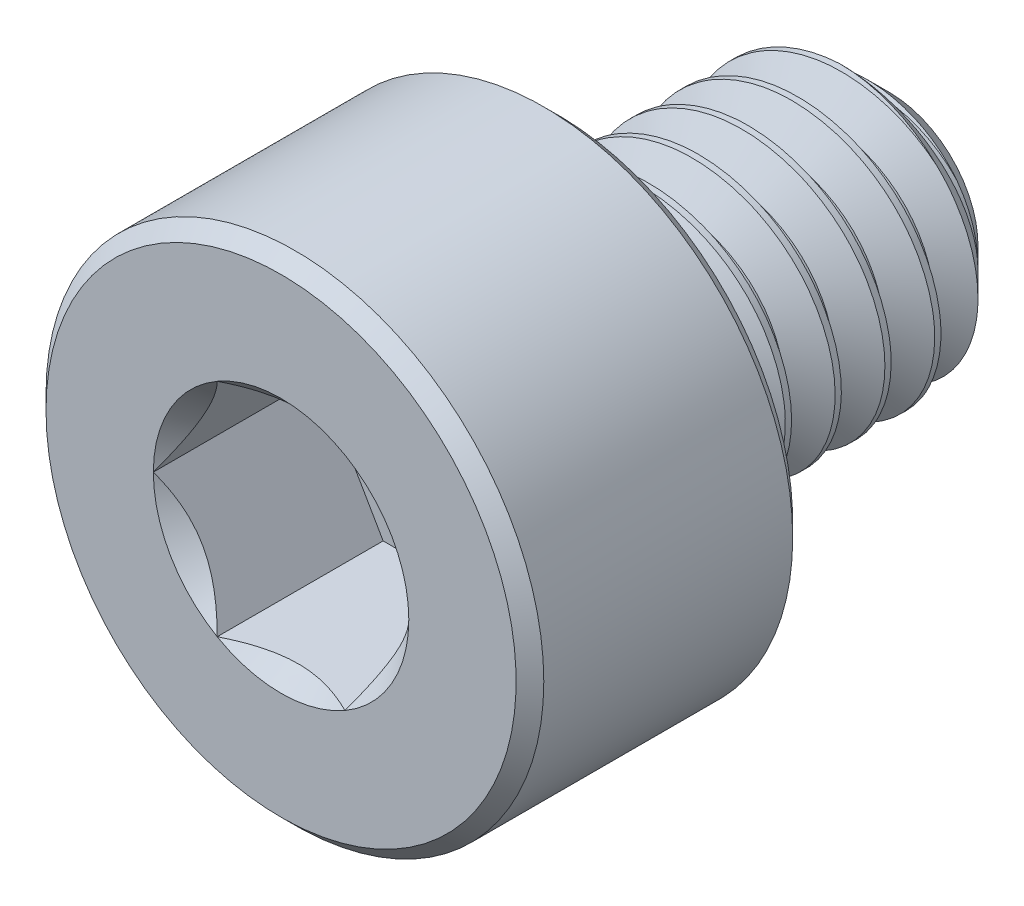
from build123d import *

# Parameters (mm, degrees)
CUT_EXTRUDE1_DEPTH = 1.5
CUT_SWEEP1_PITCH   = 0.45
CUT_SWEEP1_TO      = 3


with BuildPart() as part:
    # Sketch2 → Revolve1 (revolve)
    with BuildSketch(Plane(origin=(0, 0, 0), x_dir=(0, 0, -1), z_dir=(1, 0, 0)), mode=Mode.PRIVATE) as revolve1_sk:
        Polygon((-2.75, 0), (-2.75, 2.125), (-2.625, 2.25), (-0.375, 2.25), (-0.25, 2.125), (-0.25, 1.25), (2.3, 1.25), (2.75, 0.8), (2.75, 0), align=None)
    revolve(revolve1_sk.sketch.rotate(Axis((0, 0, -2.75), (0, 0, 1)), 90), axis=Axis((0, 0, -2.75), (0, 0, 1)))

    # Sketch3 → Cut-Extrude1 (cut)
    with BuildSketch(Plane.XY.offset(2.75)):
        Polygon((0.577350269, 1), (-0.577350269, 1), (-1.154700538, 0), (-0.577350269, -1), (0.577350269, -1), (1.154700538, 0), align=None)
    extrude(amount=-CUT_EXTRUDE1_DEPTH, mode=Mode.SUBTRACT)

    # Cut-Extrude2 cone 1 section (through the dimple's axis) → Cut-Extrude2 (revolve, cut)
    with BuildSketch(Plane(origin=(0, 0, 2.75), x_dir=(0, -1, 0), z_dir=(1, 0, 0))):
        Polygon((0, 0), (1.154700538, 0), (0, 1.154700538), align=None)
    revolve(axis=Axis((0, 0, 2.75), (0, 0, -1)), mode=Mode.SUBTRACT)


with BuildPart() as body_2:
    # Split1: read off the stored shape, not the designer's step
    # Split1: the piece on the far side of the plane
    add(part.part)
    split(bisect_by=Plane.XY.offset(0.25), keep=Keep.BOTTOM)

    # Cut-Sweep1: arcs per turn and ends read off the stored shape
    # Cut-Sweep1: the profile of Sketch7 screwed along a right-hand helix through 7.666667 turns, 6 arcs to a turn; built about Z, then put on its axis
    cut_sweep1_z = Axis((0, 0, 0), (0, 0, 1))
    cut_sweep1_corners = [(1.274356964, 0, 0.0140625), (1.274356964, 0, -0.4078125), (0.957716426, 0, -0.225), (0.957716426, 0, -0.16875)]
    with BuildLine(mode=Mode.PRIVATE) as cut_sweep1_profile:
        Line(cut_sweep1_corners[0], cut_sweep1_corners[1])
        Line(cut_sweep1_corners[1], cut_sweep1_corners[2])
        Line(cut_sweep1_corners[2], cut_sweep1_corners[3])
        Line(cut_sweep1_corners[3], cut_sweep1_corners[0])
    cut_sweep1_cap = Face(cut_sweep1_profile.wire())
    cut_sweep1_turn_angles = [0, 30, 60, 90, 120, 150, 180, 210, 240, 270, 300, 330, 360]
    cut_sweep1_turn_weights = [1, 0.8660254037844387, 1, 0.8660254037844387, 1, 0.8660254037844387, 1, 0.8660254037844387, 1, 0.8660254037844387, 1, 0.8660254037844387, 1]
    cut_sweep1_turn_rails = [Edge.make_bspline([Vector(p[0], p[1], 0).rotate(cut_sweep1_z, cut_sweep1_turn_angles[k]) / cut_sweep1_turn_weights[k] + Vector(0, 0, p[2] + CUT_SWEEP1_PITCH * cut_sweep1_turn_angles[k] / 360) for k in range(13)], [0, 0, 0, 1, 1, 2, 2, 3, 3, 4, 4, 5, 5, 6, 6, 6], 2, cut_sweep1_turn_weights) for p in cut_sweep1_corners]
    cut_sweep1_turn_sides = [Face.make_surface_from_curves(cut_sweep1_turn_rails[p[0]], cut_sweep1_turn_rails[p[1]]) for p in [(0, 1), (1, 2), (2, 3), (3, 0)]]
    cut_sweep1_last_angles = [2520, 2550, 2580, 2610, 2640, 2670, 2700, 2730, 2760]
    cut_sweep1_last_weights = [1, 0.8660254037844387, 1, 0.8660254037844387, 1, 0.8660254037844387, 1, 0.8660254037844327, 1]
    cut_sweep1_last_rails = [Edge.make_bspline([Vector(p[0], p[1], 0).rotate(cut_sweep1_z, cut_sweep1_last_angles[k]) / cut_sweep1_last_weights[k] + Vector(0, 0, p[2] + CUT_SWEEP1_PITCH * cut_sweep1_last_angles[k] / 360) for k in range(9)], [0, 0, 0, 1, 1, 2, 2, 3, 3, 4, 4, 4], 2, cut_sweep1_last_weights) for p in cut_sweep1_corners]
    cut_sweep1_last_sides = [Face.make_surface_from_curves(cut_sweep1_last_rails[p[0]], cut_sweep1_last_rails[p[1]]) for p in [(0, 1), (1, 2), (2, 3), (3, 0)]]
    cut_sweep1 = Plane(origin=(0, 0, -2.75), x_dir=(0, 1, 0), z_dir=(0, 0, 1)) * split(Solid(Shell([*[p.moved(Location((0, 0, CUT_SWEEP1_PITCH * i))) for i in range(7) for p in cut_sweep1_turn_sides], *cut_sweep1_last_sides, cut_sweep1_cap, cut_sweep1_cap.rotate(cut_sweep1_z, 2760).moved(Location((0, 0, CUT_SWEEP1_PITCH * 2760 / 360)))])), bisect_by=Plane.XY.offset(CUT_SWEEP1_TO), keep=Keep.BOTTOM, mode=Mode.PRIVATE)
    add(cut_sweep1, mode=Mode.SUBTRACT)


with BuildPart() as part_1:
    add(part.part)

    # Split1
    split(bisect_by=Plane.XY.offset(0.25), keep=Keep.TOP)

    add(body_2.part)  # Boss-Extrude1 merges body 2
    # Boss-Extrude1: read off the stored shape, not the designer's step
    # Boss-Extrude1 outline → Boss-Extrude1 (revolve)
    with BuildSketch(Plane.XZ):
        Polygon((0.957709694, 0.25), (0.957709694, 0.146494574), (1.25, 0.25), align=None)
    revolve(axis=Axis((0, 0, 0), (0, 0, 1)))


solid = part_1.part
